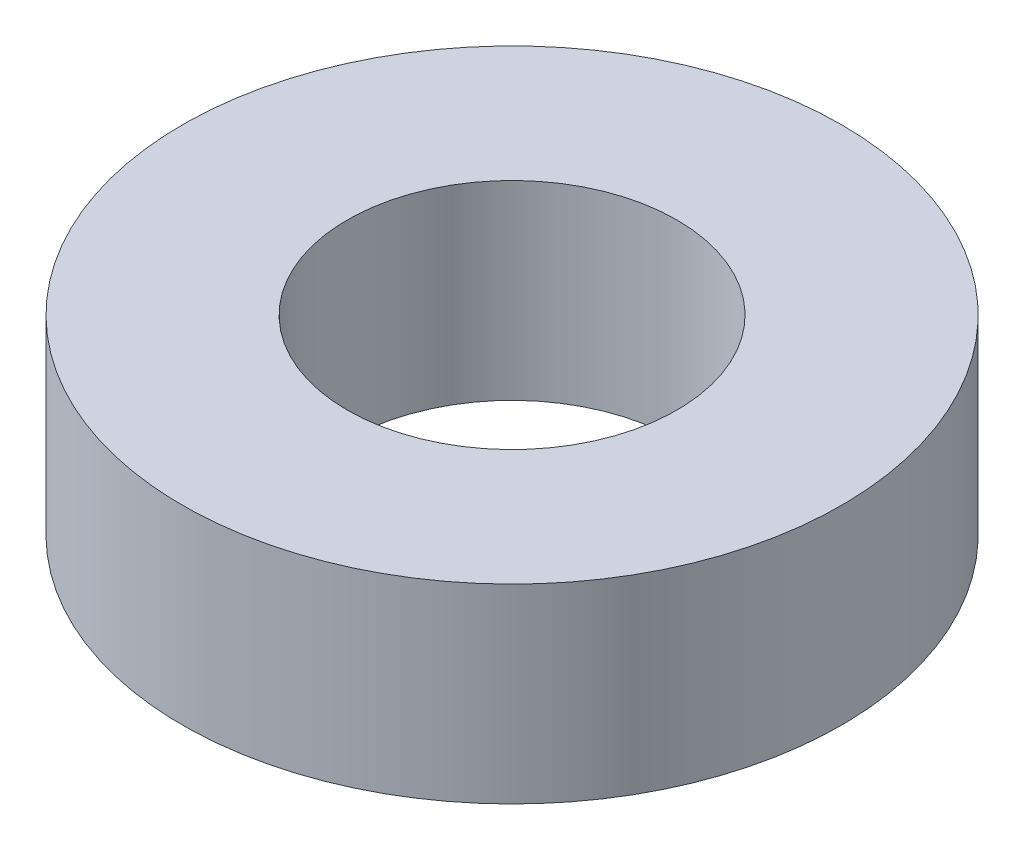
from build123d import *

# Parameters (mm, degrees)
SKETCH1_R           = 45
BOSS_EXTRUDE1_DEPTH = 26
SKETCH2_R           = 22.5
CUT_EXTRUDE1_DEPTH  = 69.745908969


with BuildPart() as part:
    # Sketch1 → Boss-Extrude1 (new body)
    with BuildSketch(Plane(origin=(0, 0, 0), x_dir=(1, 0, 0), z_dir=(0, 1, 0))):
        Circle(SKETCH1_R)
    extrude(amount=BOSS_EXTRUDE1_DEPTH)

    # Sketch2 → Cut-Extrude1 (cut, through all)
    with BuildSketch(Plane(origin=(0, 0, 0), x_dir=(1, 0, 0), z_dir=(0, 1, 0))):
        Circle(SKETCH2_R)
    extrude(amount=CUT_EXTRUDE1_DEPTH, mode=Mode.SUBTRACT)


solid = part.part
